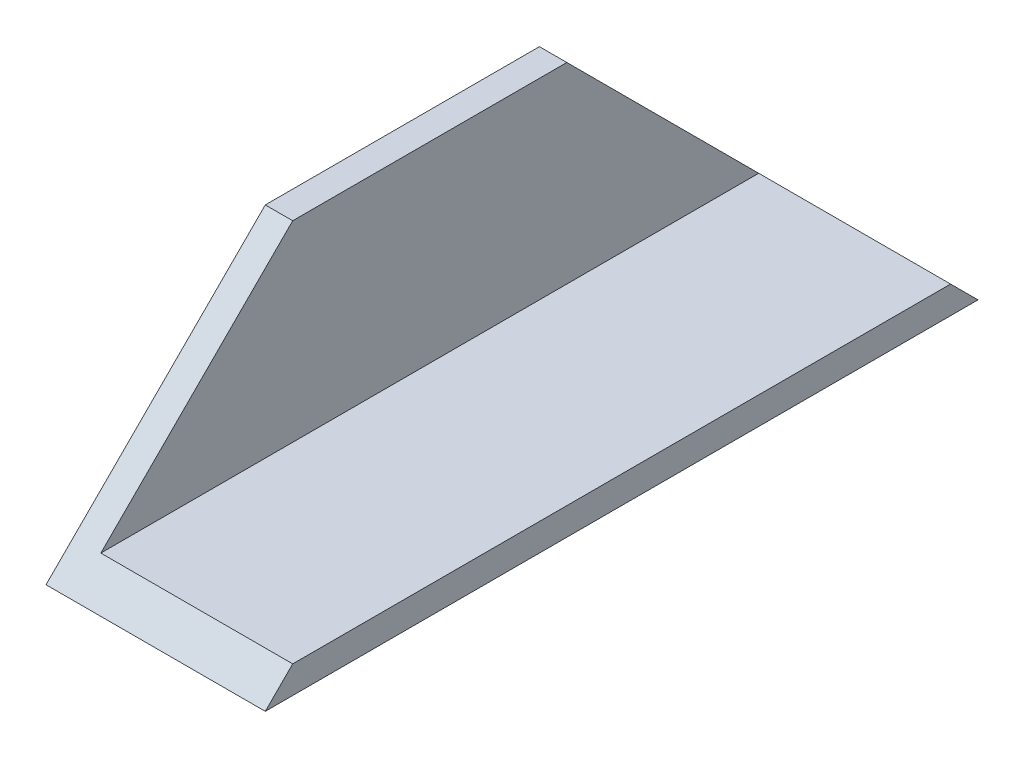
from build123d import *

# Parameters (mm, degrees)
BOSS_EXTRUDE1_DEPTH = 82.55
CHAMFER1_SIZE       = 25.4


with BuildPart() as part:
    # Sketch1 → Boss-Extrude1 (new body)
    with BuildSketch(Plane.XY):
        Polygon((0, 25.4), (0, 0), (25.4, 0), (25.4, 3.175), (3.175, 3.175), (3.175, 25.4), align=None)
    extrude(amount=BOSS_EXTRUDE1_DEPTH)

    # Chamfer1
    chamfer1_edges = [part.edges().sort_by_distance(p)[0] for p in [
        (1.5875, 25.4, 0),
        (1.5875, 25.4, 82.55),
    ]]
    chamfer(chamfer1_edges, length=CHAMFER1_SIZE - 0.0001)  # a hair under: the kernel refuses the full size


solid = part.part
